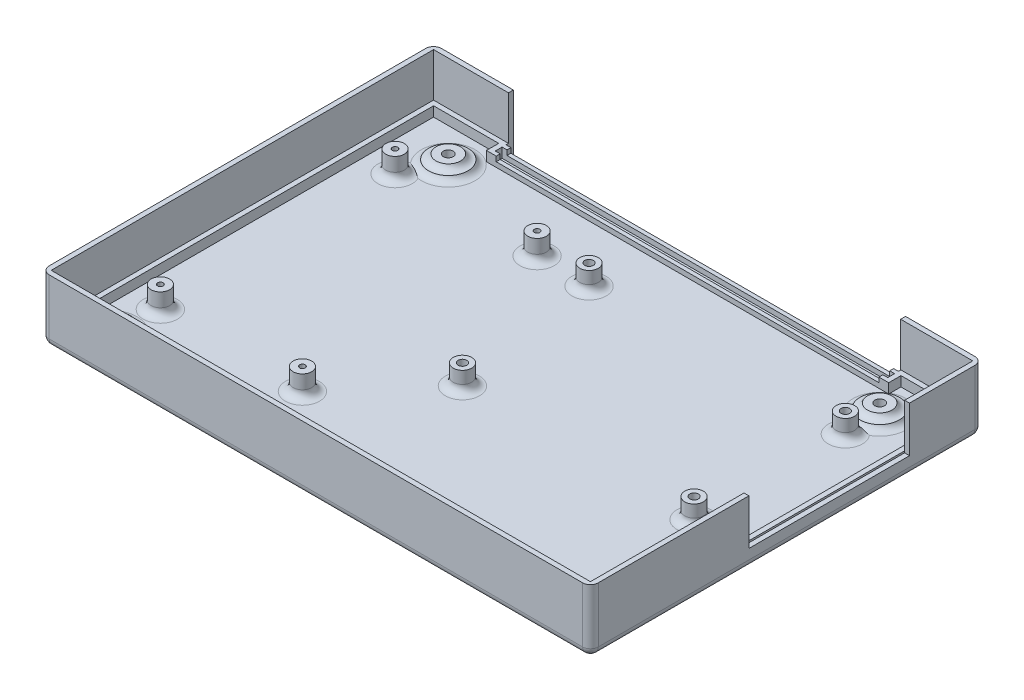
from build123d import *

# Parameters (mm, degrees)
SKETCH1_W            = 177.8
SKETCH1_H            = 127
BOSS_EXTRUDE1_DEPTH  = 20.525
SKETCH2_W            = 174.625
SKETCH2_H            = 123.825
CUT_EXTRUDE1_DEPTH   = 14.175
FILLET2_R            = 2.54
SKETCH4_W            = 127
SKETCH4_H            = 1.5875
CUT_EXTRUDE2_DEPTH   = 17.175
CUT_EXTRUDE3_START   = 3.175
SKETCH11_W           = 171.45
SKETCH11_H           = 120.65
CUT_EXTRUDE3_DEPTH   = 3.175
SKETCH7_W            = 18.160040686
SKETCH7_H            = 2.214639108
BOSS_EXTRUDE3_DEPTH  = 9.525
CUT_EXTRUDE5_START   = -3.175
SKETCH16_R           = 3.96875
CUT_EXTRUDE5_DEPTH   = 2.54
SKETCH17_W           = 127
SKETCH17_H           = 1.5875
CUT_EXTRUDE6_DEPTH   = 12.7
CUT_EXTRUDE7_START   = 3.175
SKETCH18_W           = 127.096655316
SKETCH18_H           = 1.5875
CUT_EXTRUDE7_DEPTH   = 3.175
SKETCH20_W           = 130.271655316
SKETCH20_H           = 4.7625
BOSS_EXTRUDE7_DEPTH  = 3.175
SKETCH21_W           = 127.096655316
SKETCH21_H           = 0.79375
CUT_EXTRUDE10_DEPTH  = 3.175
SKETCH23_W           = 127.096655316
SKETCH23_H           = 2.2225
CUT_EXTRUDE11_DEPTH  = 3.175
SKETCH24_W           = 123.921655316
SKETCH24_H           = 4.7625
CUT_EXTRUDE13_DEPTH  = 1.5875
SKETCH26_R           = 6.35
BOSS_EXTRUDE8_DEPTH  = 1.5875
SKETCH28_R           = 3.96875
BOSS_EXTRUDE9_DEPTH  = 1.5875
SKETCH29_R           = 1.5875
CUT_EXTRUDE14_DEPTH  = 12.7
CUT_EXTRUDE15_START  = -6.35
SKETCH30_R           = 3.96875
CUT_EXTRUDE15_DEPTH  = 2.54
SKETCH31_R           = 3
SKETCH31_R_2         = 1.4
SKETCH31_R_3         = 2.999999996
BOSS_EXTRUDE10_DEPTH = 6.5
SKETCH32_R           = 3
SKETCH32_R_2         = 0.9
BOSS_EXTRUDE11_DEPTH = 7
SKETCH33_R           = 6.35
BOSS_EXTRUDE13_DEPTH = 1.5875
SKETCH34_R           = 3.96875
BOSS_EXTRUDE14_DEPTH = 1.5875
SKETCH35_R           = 1.5875
CUT_EXTRUDE16_DEPTH  = 12.7
FILLET3_R            = 2.54
SKETCH36_W           = 1.5875
SKETCH36_H           = 52.002533256
CUT_EXTRUDE17_DEPTH  = 14.75


with BuildPart() as part:
    # Sketch1 → Boss-Extrude1 (new body)
    with BuildSketch(Plane(origin=(0, 0, 0), x_dir=(1, 0, 0), z_dir=(0, 1, 0))):
        Rectangle(SKETCH1_W, SKETCH1_H)
    extrude(amount=BOSS_EXTRUDE1_DEPTH)

    # Sketch2 → Cut-Extrude1 (cut)
    with BuildSketch(Plane(origin=(0, 20.525, 0), x_dir=(1, 0, 0), z_dir=(0, 1, 0))):
        Rectangle(SKETCH2_W, SKETCH2_H)
    extrude(amount=-CUT_EXTRUDE1_DEPTH, mode=Mode.SUBTRACT)

    # Fillet2
    fillet2_edges = [part.edges().sort_by_distance(p)[0] for p in [
        (0, 0, 63.5),
        (-88.9, 0, 0),
        (0, 0, -63.5),
        (88.9, 0, 0),
        (88.9, 10.2625, 63.5),
        (-88.9, 10.2625, 63.5),
        (-88.9, 10.2625, -63.5),
        (88.9, 10.2625, -63.5),
    ]]
    fillet(fillet2_edges, radius=FILLET2_R)

    # Sketch4 → Cut-Extrude2 (cut)
    with BuildSketch(Plane(origin=(0, 6.35, 0), x_dir=(1, 0, 0), z_dir=(0, 1, 0))):
        with Locations((0.449959467, 62.70625)):
            Rectangle(SKETCH4_W, SKETCH4_H)
    extrude(amount=CUT_EXTRUDE2_DEPTH, mode=Mode.SUBTRACT)

    # Sketch11 → Cut-Extrude3 (cut)
    with BuildSketch(Plane(origin=(0, 0, 0), x_dir=(1, 0, 0), z_dir=(0, 1, 0)).offset(CUT_EXTRUDE3_START)):
        Rectangle(SKETCH11_W, SKETCH11_H)
    extrude(amount=CUT_EXTRUDE3_DEPTH, mode=Mode.SUBTRACT)

    # Sketch7 → Boss-Extrude3 (add)
    with BuildSketch(Plane(origin=(0, 0, 0), x_dir=(1, 0, 0), z_dir=(0, 1, 0))):
        with Locations((-42.521070875, -59.217680446)):
            Rectangle(SKETCH7_W, SKETCH7_H)
    boss_extrude3 = extrude(amount=BOSS_EXTRUDE3_DEPTH)

    # Mirror1: Boss-Extrude3 across plane
    add(boss_extrude3.mirror(Plane(origin=(0, 0, 0), x_dir=(0, 0, 1), z_dir=(1, 0, 0))))

    # Sketch16 → Cut-Extrude5 (cut)
    with BuildSketch(Plane(origin=(0, 3.175, 0), x_dir=(1, 0, 0), z_dir=(0, 1, 0)).offset(CUT_EXTRUDE5_START)):
        with Locations(Location((-77.755269654, -52.350082539, 0), (0, 0, 90))):
            Circle(SKETCH16_R)
    cut_extrude5 = extrude(amount=CUT_EXTRUDE5_DEPTH, mode=Mode.SUBTRACT)

    # Sketch17 → Cut-Extrude6 (cut)
    with BuildSketch(Plane(origin=(0, 0, 0), x_dir=(1, 0, 0), z_dir=(0, 1, 0))):
        with Locations((0.449959467, 62.70625)):
            Rectangle(SKETCH17_W, SKETCH17_H)
    extrude(amount=CUT_EXTRUDE6_DEPTH, mode=Mode.SUBTRACT)

    # Sketch18 → Cut-Extrude7 (cut)
    with BuildSketch(Plane(origin=(0, 0, 0), x_dir=(1, 0, 0), z_dir=(0, 1, 0)).offset(CUT_EXTRUDE7_START)):
        with Locations((0.498287125, 61.11875)):
            Rectangle(SKETCH18_W, SKETCH18_H)
    extrude(amount=CUT_EXTRUDE7_DEPTH, mode=Mode.SUBTRACT)

    # Sketch20 → Boss-Extrude7 (add)
    with BuildSketch(Plane(origin=(0, 3.175, 0), x_dir=(1, 0, 0), z_dir=(0, 1, 0))):
        with Locations((0.498287125, 58.7375)):
            Rectangle(SKETCH20_W, SKETCH20_H)
    extrude(amount=BOSS_EXTRUDE7_DEPTH)

    # Sketch21 → Cut-Extrude10 (cut)
    with BuildSketch(Plane(origin=(0, 3.175, 0), x_dir=(1, 0, 0), z_dir=(0, 1, 0))):
        with Locations((0.498287125, 61.515625)):
            Rectangle(SKETCH21_W, SKETCH21_H)
    extrude(amount=-CUT_EXTRUDE10_DEPTH, mode=Mode.SUBTRACT)

    # Sketch23 → Cut-Extrude11 (cut)
    with BuildSketch(Plane(origin=(0, 6.35, 0), x_dir=(1, 0, 0), z_dir=(0, 1, 0))):
        with Locations((0.498287125, 58.7375)):
            Rectangle(SKETCH23_W, SKETCH23_H)
    extrude(amount=-CUT_EXTRUDE11_DEPTH, mode=Mode.SUBTRACT)

    # Sketch24 → Cut-Extrude13 (cut)
    with BuildSketch(Plane(origin=(0, 6.35, 0), x_dir=(1, 0, 0), z_dir=(0, 1, 0))):
        with Locations((0.498287125, 58.7375)):
            Rectangle(SKETCH24_W, SKETCH24_H)
    extrude(amount=-CUT_EXTRUDE13_DEPTH, mode=Mode.SUBTRACT)

    # Sketch26 → Boss-Extrude8 (add)
    with BuildSketch(Plane(origin=(0, 3.175, 0), x_dir=(1, 0, 0), z_dir=(0, 1, 0))):
        with Locations(Location((69.85, 49.2125, 0), (0, 0, 90))):
            Circle(SKETCH26_R)
    boss_extrude8 = extrude(amount=BOSS_EXTRUDE8_DEPTH)

    # Sketch28 → Boss-Extrude9 (add)
    with BuildSketch(Plane(origin=(0, 4.7625, 0), x_dir=(1, 0, 0), z_dir=(0, 1, 0))):
        with Locations(Location((69.85, 49.2125, 0), (0, 0, 270))):
            Circle(SKETCH28_R)
    boss_extrude9 = extrude(amount=BOSS_EXTRUDE9_DEPTH)

    # Sketch29 → Cut-Extrude14 (cut)
    with BuildSketch(Plane(origin=(0, 6.35, 0), x_dir=(1, 0, 0), z_dir=(0, 1, 0))):
        with Locations(Location((69.85, 49.2125, 0), (0, 0, 270))):
            Circle(SKETCH29_R)
    cut_extrude14 = extrude(amount=-CUT_EXTRUDE14_DEPTH, mode=Mode.SUBTRACT)

    # Sketch30 → Cut-Extrude15 (cut)
    with BuildSketch(Plane(origin=(0, 6.35, 0), x_dir=(1, 0, 0), z_dir=(0, 1, 0)).offset(CUT_EXTRUDE15_START)):
        with Locations(Location((69.85, 49.2125, 0), (0, 0, 270))):
            Circle(SKETCH30_R)
    cut_extrude15 = extrude(amount=CUT_EXTRUDE15_DEPTH, mode=Mode.SUBTRACT)

    # Mirror7: Boss-Extrude8, Boss-Extrude9, Cut-Extrude14, Cut-Extrude15 across plane
    add(boss_extrude8.mirror(Plane(origin=(0, 0, 0), x_dir=(0, 0, 1), z_dir=(1, 0, 0))))
    add(boss_extrude9.mirror(Plane(origin=(0, 0, 0), x_dir=(0, 0, 1), z_dir=(1, 0, 0))))
    add(cut_extrude14.mirror(Plane(origin=(0, 0, 0), x_dir=(0, 0, 1), z_dir=(1, 0, 0))), mode=Mode.SUBTRACT)
    add(cut_extrude15.mirror(Plane(origin=(0, 0, 0), x_dir=(0, 0, 1), z_dir=(1, 0, 0))), mode=Mode.SUBTRACT)

    # Sketch31 → Boss-Extrude10 (add)
    # profile 1 of 4: a face of its own
    with BuildSketch(Plane(origin=(0, 3.175, 0), x_dir=(1, 0, 0), z_dir=(0, 1, 0))):
        with Locations(Location((69.85, 38.1, 0), (0, 0, 90))):
            Circle(SKETCH31_R)
        with Locations(Location((69.85, 38.1, 0), (0, 0, 90))):
            Circle(SKETCH31_R_2, mode=Mode.SUBTRACT)
    # profile 2 of 4: a face of its own
    with BuildSketch(Plane(origin=(0, 3.175, 0), x_dir=(1, 0, 0), z_dir=(0, 1, 0))):
        with Locations(Location((-13.150000116, 38.1, 0), (0, 0, 90))):
            Circle(SKETCH31_R)
        with Locations(Location((-13.150000116, 38.1, 0), (0, 0, 90))):
            Circle(SKETCH31_R_2, mode=Mode.SUBTRACT)
    # profile 3 of 4: a face of its own
    with BuildSketch(Plane(origin=(0, 3.175, 0), x_dir=(1, 0, 0), z_dir=(0, 1, 0))):
        with Locations(Location((69.34999994, -10.397422639, 0), (0, 0, 90))):
            Circle(SKETCH31_R)
        with Locations(Location((69.34999994, -10.397422639, 0), (0, 0, 90))):
            Circle(SKETCH31_R_2, mode=Mode.SUBTRACT)
    # profile 4 of 4: a face of its own
    with BuildSketch(Plane(origin=(0, 3.175, 0), x_dir=(1, 0, 0), z_dir=(0, 1, 0))):
        with Locations(Location((-5.650000016, -10.4, 0), (0, 0, 90))):
            Circle(SKETCH31_R_3)
        with Locations(Location((-5.650000016, -10.4, 0), (0, 0, 90))):
            Circle(SKETCH31_R_2, mode=Mode.SUBTRACT)
    extrude(amount=BOSS_EXTRUDE10_DEPTH)

    # Sketch32 → Boss-Extrude11 (add)
    # profile 1 of 4: a face of its own
    with BuildSketch(Plane(origin=(0, 3.175, 0), x_dir=(1, 0, 0), z_dir=(0, 1, 0))):
        with Locations(Location((-76.052790861, 38.179091747, 0), (0, 0, 90))):
            Circle(SKETCH32_R)
        with Locations(Location((-76.052790861, 38.179091747, 0), (0, 0, 270))):
            Circle(SKETCH32_R_2, mode=Mode.SUBTRACT)
    # profile 2 of 4: a face of its own
    with BuildSketch(Plane(origin=(0, 3.175, 0), x_dir=(1, 0, 0), z_dir=(0, 1, 0))):
        with Locations(Location((-30.05279093, 38.177869698, 0), (0, 0, 90))):
            Circle(SKETCH32_R)
        with Locations(Location((-30.05279093, 38.177869698, 0), (0, 0, 270))):
            Circle(SKETCH32_R_2, mode=Mode.SUBTRACT)
    # profile 3 of 4: a face of its own
    with BuildSketch(Plane(origin=(0, 3.175, 0), x_dir=(1, 0, 0), z_dir=(0, 1, 0))):
        with Locations(Location((-76.052790878, -37.820908145, 0), (0, 0, 90))):
            Circle(SKETCH32_R)
        with Locations(Location((-76.052790878, -37.820908145, 0), (0, 0, 270))):
            Circle(SKETCH32_R_2, mode=Mode.SUBTRACT)
    # profile 4 of 4: a face of its own
    with BuildSketch(Plane(origin=(0, 3.175, 0), x_dir=(1, 0, 0), z_dir=(0, 1, 0))):
        with Locations(Location((-30.05279093, -37.822130194, 0), (0, 0, 90))):
            Circle(SKETCH32_R)
        with Locations(Location((-30.05279093, -37.822130194, 0), (0, 0, 270))):
            Circle(SKETCH32_R_2, mode=Mode.SUBTRACT)
    extrude(amount=BOSS_EXTRUDE11_DEPTH)

    # Sketch33 → Boss-Extrude13 (add)
    with BuildSketch(Plane(origin=(0, 3.175, 0), x_dir=(1, 0, 0), z_dir=(0, 1, 0))):
        with Locations(Location((-77.7875, -52.3875, 0), (0, 0, 90))):
            Circle(SKETCH33_R)
        with Locations(Location((77.7875, -52.3875, 0), (0, 0, 90))):
            Circle(SKETCH33_R)
    extrude(amount=BOSS_EXTRUDE13_DEPTH)

    # Sketch34 → Boss-Extrude14 (add)
    with BuildSketch(Plane(origin=(0, 4.7625, 0), x_dir=(1, 0, 0), z_dir=(0, 1, 0))):
        with Locations(Location((-77.7875, -52.3875, 0), (0, 0, 270))):
            Circle(SKETCH34_R)
        with Locations(Location((77.7875, -52.3875, 0), (0, 0, 270))):
            Circle(SKETCH34_R)
    extrude(amount=BOSS_EXTRUDE14_DEPTH)

    # Sketch35 → Cut-Extrude16 (cut)
    with BuildSketch(Plane(origin=(0, 6.35, 0), x_dir=(1, 0, 0), z_dir=(0, 1, 0))):
        with Locations(Location((-77.7875, -52.3875, 0), (0, 0, 270))):
            Circle(SKETCH35_R)
        with Locations(Location((77.7875, -52.3875, 0), (0, 0, 270))):
            Circle(SKETCH35_R)
    extrude(amount=-CUT_EXTRUDE16_DEPTH, mode=Mode.SUBTRACT)

    # Mirror8: Cut-Extrude5 across plane
    add(cut_extrude5.mirror(Plane(origin=(0, 0, 0), x_dir=(0, 0, 1), z_dir=(1, 0, 0))), mode=Mode.SUBTRACT)

    # Fillet3
    # the kernel refuses this fillet: 2.54 mm, written as the material it adds along each edge
    with BuildSketch(Plane(origin=(69.85, 3.175, -49.2125), x_dir=(0, 0, -1), z_dir=(1, 0, 0))) as fillet3_piece_1:
        with BuildLine():
            CenterArc((8.70464302, 2.54), FILLET3_R, 202.024312837, 67.975687163)
            Line((6.35, 1.5875), (6.35, 0))
            Line((6.35, 0), (8.70464302, 0))
        make_face()
    revolve(axis=Axis((69.85, 3.175, -49.2125), (0, 1, 0)))
    with BuildSketch(Plane(origin=(69.85, 4.7625, -49.2125), x_dir=(0, 0, 1), z_dir=(-1, 0, 0))) as fillet3_piece_2:
        with BuildLine():
            CenterArc((6.32339302, 2.54), FILLET3_R, 202.024312837, 67.975687163)
            Line((3.96875, 1.5875), (3.96875, 0))
            Line((3.96875, 0), (6.32339302, 0))
        make_face()
    revolve(axis=Axis((69.85, 4.7625, -49.2125), (0, 1, 0)))
    with BuildSketch(Plane(origin=(-69.85, 3.175, -49.2125), x_dir=(0, 0, -1), z_dir=(-1, 0, 0))) as fillet3_piece_3:
        with BuildLine():
            CenterArc((8.70464302, -2.54), FILLET3_R, 90, 67.975687163)
            Line((6.35, -1.5875), (6.35, 0))
            Line((6.35, 0), (8.70464302, 0))
        make_face()
    revolve(axis=Axis((-69.85, 3.175, -49.2125), (0, -1, 0)))
    with BuildSketch(Plane(origin=(-69.85, 4.7625, -49.2125), x_dir=(0, 0, 1), z_dir=(1, 0, 0))) as fillet3_piece_4:
        with BuildLine():
            CenterArc((6.32339302, -2.54), FILLET3_R, 90, 67.975687163)
            Line((3.96875, -1.5875), (3.96875, 0))
            Line((3.96875, 0), (6.32339302, 0))
        make_face()
    revolve(axis=Axis((-69.85, 4.7625, -49.2125), (0, -1, 0)))
    with BuildSketch(Plane(origin=(69.85, 3.175, -38.1), x_dir=(0, 0, -1), z_dir=(1, 0, 0))) as fillet3_piece_5:
        with BuildLine():
            CenterArc((3 + FILLET3_R, FILLET3_R), FILLET3_R, 180, 90)
            Line((3, FILLET3_R), (3, 0))
            Line((3, 0), (3 + FILLET3_R, 0))
        make_face()
    revolve(axis=Axis((69.85, 3.175, -38.1), (0, 1, 0)))
    with BuildSketch(Plane(origin=(-13.150000116, 3.175, -38.1), x_dir=(0, 0, -1), z_dir=(1, 0, 0))) as fillet3_piece_6:
        with BuildLine():
            CenterArc((3 + FILLET3_R, FILLET3_R), FILLET3_R, 180, 90)
            Line((3, FILLET3_R), (3, 0))
            Line((3, 0), (3 + FILLET3_R, 0))
        make_face()
    revolve(axis=Axis((-13.150000116, 3.175, -38.1), (0, 1, 0)))
    with BuildSketch(Plane(origin=(69.34999994, 3.175, 10.397422639), x_dir=(0, 0, -1), z_dir=(1, 0, 0))) as fillet3_piece_7:
        with BuildLine():
            CenterArc((3 + FILLET3_R, FILLET3_R), FILLET3_R, 180, 90)
            Line((3, FILLET3_R), (3, 0))
            Line((3, 0), (3 + FILLET3_R, 0))
        make_face()
    revolve(axis=Axis((69.34999994, 3.175, 10.397422639), (0, 1, 0)))
    with BuildSketch(Plane(origin=(-5.650000016, 3.175, 10.4), x_dir=(0, 0, -1), z_dir=(1, 0, 0))) as fillet3_piece_8:
        with BuildLine():
            CenterArc((2.999999996 + FILLET3_R, FILLET3_R), FILLET3_R, 180, 90)
            Line((2.999999996, FILLET3_R), (2.999999996, 0))
            Line((2.999999996, 0), (2.999999996 + FILLET3_R, 0))
        make_face()
    revolve(axis=Axis((-5.650000016, 3.175, 10.4), (0, 1, 0)))
    with BuildSketch(Plane(origin=(-76.052790861, 3.175, -38.179091747), x_dir=(0, 0, -1), z_dir=(1, 0, 0))) as fillet3_piece_9:
        with BuildLine():
            CenterArc((3 + FILLET3_R, FILLET3_R), FILLET3_R, 180, 90)
            Line((3, FILLET3_R), (3, 0))
            Line((3, 0), (3 + FILLET3_R, 0))
        make_face()
    revolve(axis=Axis((-76.052790861, 3.175, -38.179091747), (0, 1, 0)))
    with BuildSketch(Plane(origin=(-30.05279093, 3.175, -38.177869698), x_dir=(0, 0, -1), z_dir=(1, 0, 0))) as fillet3_piece_10:
        with BuildLine():
            CenterArc((3 + FILLET3_R, FILLET3_R), FILLET3_R, 180, 90)
            Line((3, FILLET3_R), (3, 0))
            Line((3, 0), (3 + FILLET3_R, 0))
        make_face()
    revolve(axis=Axis((-30.05279093, 3.175, -38.177869698), (0, 1, 0)))
    with BuildSketch(Plane(origin=(-76.052790878, 3.175, 37.820908145), x_dir=(0, 0, -1), z_dir=(1, 0, 0))) as fillet3_piece_11:
        with BuildLine():
            CenterArc((3 + FILLET3_R, FILLET3_R), FILLET3_R, 180, 90)
            Line((3, FILLET3_R), (3, 0))
            Line((3, 0), (3 + FILLET3_R, 0))
        make_face()
    revolve(axis=Axis((-76.052790878, 3.175, 37.820908145), (0, 1, 0)))
    with BuildSketch(Plane(origin=(-30.05279093, 3.175, 37.822130194), x_dir=(0, 0, -1), z_dir=(1, 0, 0))) as fillet3_piece_12:
        with BuildLine():
            CenterArc((3 + FILLET3_R, FILLET3_R), FILLET3_R, 180, 90)
            Line((3, FILLET3_R), (3, 0))
            Line((3, 0), (3 + FILLET3_R, 0))
        make_face()
    revolve(axis=Axis((-30.05279093, 3.175, 37.822130194), (0, 1, 0)))
    with BuildSketch(Plane(origin=(-77.7875, 3.175, 52.3875), x_dir=(0, 0, -1), z_dir=(1, 0, 0))) as fillet3_piece_13:
        with BuildLine():
            CenterArc((8.70464302, 2.54), FILLET3_R, 202.024312837, 67.975687163)
            Line((6.35, 1.5875), (6.35, 0))
            Line((6.35, 0), (8.70464302, 0))
        make_face()
    revolve(axis=Axis((-77.7875, 3.175, 52.3875), (0, 1, 0)))
    with BuildSketch(Plane(origin=(77.7875, 3.175, 52.3875), x_dir=(0, 0, -1), z_dir=(1, 0, 0))) as fillet3_piece_14:
        with BuildLine():
            CenterArc((8.70464302, 2.54), FILLET3_R, 202.024312837, 67.975687163)
            Line((6.35, 1.5875), (6.35, 0))
            Line((6.35, 0), (8.70464302, 0))
        make_face()
    revolve(axis=Axis((77.7875, 3.175, 52.3875), (0, 1, 0)))
    with BuildSketch(Plane(origin=(-77.7875, 4.7625, 52.3875), x_dir=(0, 0, 1), z_dir=(-1, 0, 0))) as fillet3_piece_15:
        with BuildLine():
            CenterArc((6.32339302, 2.54), FILLET3_R, 202.024312837, 67.975687163)
            Line((3.96875, 1.5875), (3.96875, 0))
            Line((3.96875, 0), (6.32339302, 0))
        make_face()
    revolve(axis=Axis((-77.7875, 4.7625, 52.3875), (0, 1, 0)))
    with BuildSketch(Plane(origin=(77.7875, 4.7625, 52.3875), x_dir=(0, 0, 1), z_dir=(-1, 0, 0))) as fillet3_piece_16:
        with BuildLine():
            CenterArc((6.32339302, 2.54), FILLET3_R, 202.024312837, 67.975687163)
            Line((3.96875, 1.5875), (3.96875, 0))
            Line((3.96875, 0), (6.32339302, 0))
        make_face()
    revolve(axis=Axis((77.7875, 4.7625, 52.3875), (0, 1, 0)))

    # Sketch36 → Cut-Extrude17 (cut)
    with BuildSketch(Plane(origin=(0, 20.525, 0), x_dir=(1, 0, 0), z_dir=(0, 1, 0))):
        with Locations((88.10625, 13.828388993)):
            Rectangle(SKETCH36_W, SKETCH36_H)
    extrude(amount=-CUT_EXTRUDE17_DEPTH, mode=Mode.SUBTRACT)


solid = part.part
